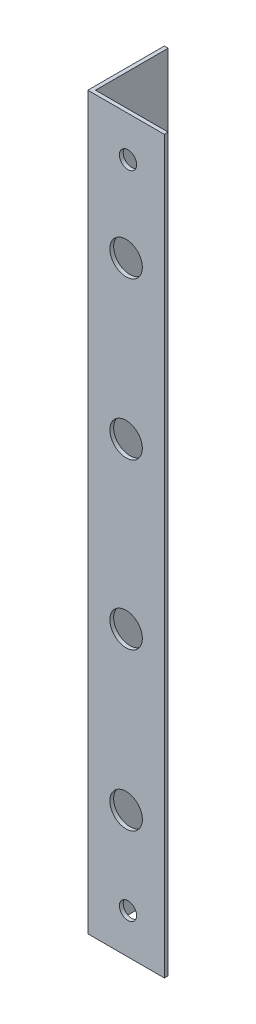
from build123d import *

# Parameters (mm, degrees)
EXTRUDE_1_DEPTH     = 191
SKETCH_2_R          = 4.25
CUT_EXTRUDE_1_DEPTH = 194.082883757
SKETCH_3_R          = 2.25
CUT_EXTRUDE_2_DEPTH = 193.981864433


with BuildPart() as part:
    # Эскиз1 → Бобышка-Вытянуть1 (new body)
    with BuildSketch(Plane(origin=(0, 0, 0), x_dir=(1, 0, 0), z_dir=(0, 1, 0))):
        Polygon((0, 0), (0, 20), (1, 20), (1, 1), (20, 1), (20, 0), align=None)
    extrude(amount=EXTRUDE_1_DEPTH)

    # Эскиз2 → Вырез-Вытянуть1 (cut, through all)
    with BuildSketch(Plane.XY):
        with Locations((10, 158)):
            Circle(SKETCH_2_R)
        with Locations((10, 117)):
            Circle(SKETCH_2_R)
        with Locations((10, 74)):
            Circle(SKETCH_2_R)
        with Locations((10, 33)):
            Circle(SKETCH_2_R)
    extrude(amount=-CUT_EXTRUDE_1_DEPTH, mode=Mode.SUBTRACT)

    # Эскиз3 → Вырез-Вытянуть2 (cut, through all)
    with BuildSketch(Plane(origin=(0, 0, -1), x_dir=(-1, 0, 0), z_dir=(0, 0, -1))):
        with Locations((-10.5, 10.5)):
            Circle(SKETCH_3_R)
        with Locations((-10.5, 180.5)):
            Circle(SKETCH_3_R)
    extrude(amount=-CUT_EXTRUDE_2_DEPTH, mode=Mode.SUBTRACT)


solid = part.part
